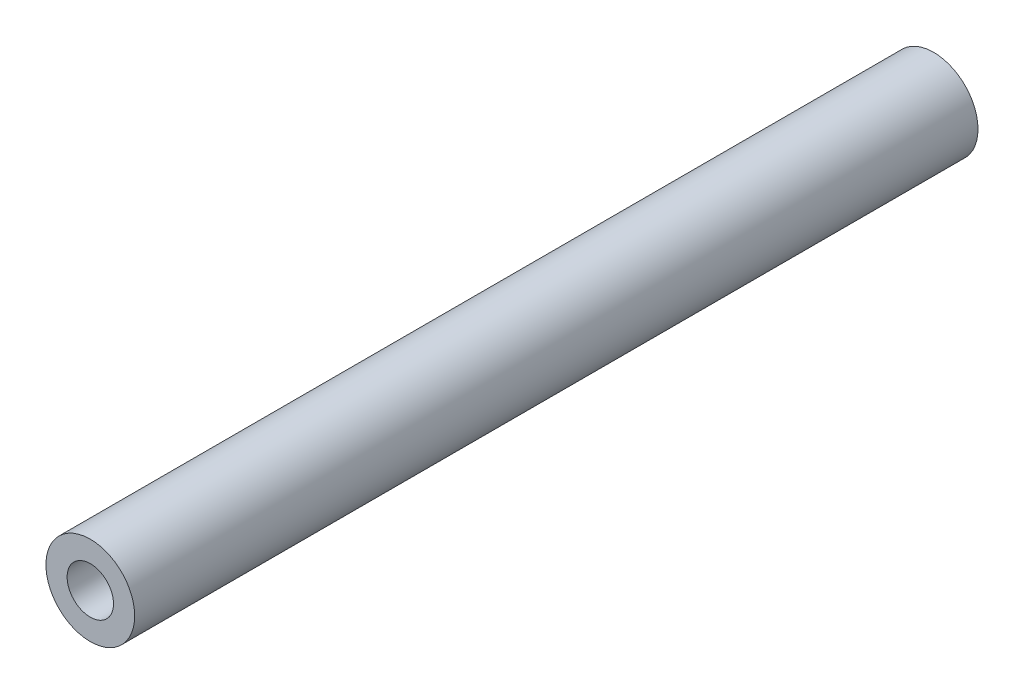
from build123d import *

# Parameters (mm, degrees)
SKETCH1_R           = 4.7625
SKETCH1_R_2         = 2.4892
BOSS_EXTRUDE1_DEPTH = 90.4875


with BuildPart() as part:
    # Sketch1 → Boss-Extrude1 (new body)
    with BuildSketch(Plane.XY):
        Circle(SKETCH1_R)
        Circle(SKETCH1_R_2, mode=Mode.SUBTRACT)
    extrude(amount=BOSS_EXTRUDE1_DEPTH)


solid = part.part
